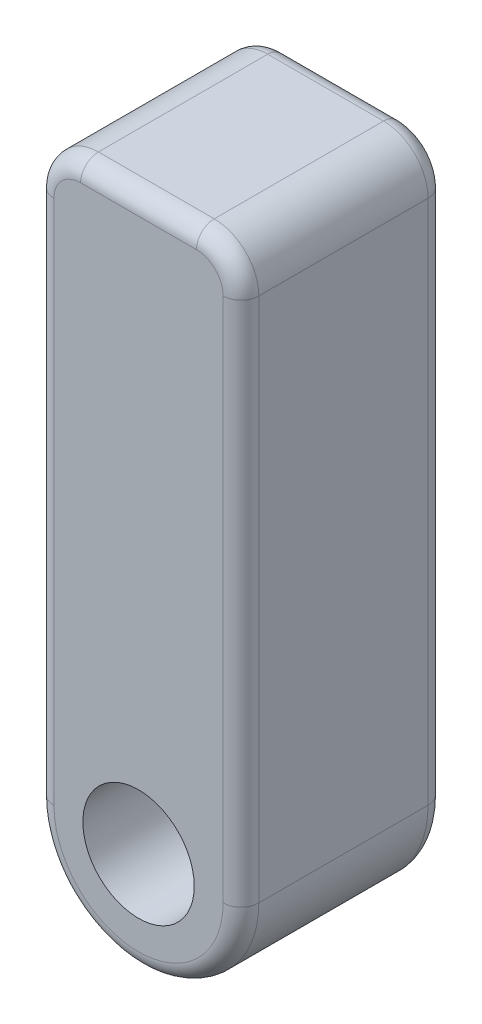
from build123d import *

# Parameters (mm, degrees)
SKETCH1_W           = 10.4
SKETCH1_H           = 15.4
SKETCH1_R           = 6.25
BOSS_EXTRUDE1_DEPTH = 23
CHAMFER2_SIZE       = 1
CHAMFER2_SIZE2      = 2.747477419
FILLET2_R           = 5
FILLET3_R           = 2
SKETCH2_W           = 10.4
SKETCH2_H           = 15.4
BOSS_EXTRUDE2_DEPTH = 1


with BuildPart() as part:
    # Sketch1 → Boss-Extrude1 (new body)
    with BuildSketch(Plane.XY):
        with BuildLine():
            Line((-11.5, 64), (-11.5, 4e-09))
            ThreePointArc((-11.5, 4e-09), (-2e-09, -11.5), (11.5, 0))
            Line((11.5, 0), (11.5, 64))
            Line((11.5, 64), (-11.5, 64))
        make_face()
        with Locations((0, 48.7)):
            Rectangle(SKETCH1_W, SKETCH1_H, mode=Mode.SUBTRACT)
        Circle(SKETCH1_R, mode=Mode.SUBTRACT)
    extrude(amount=BOSS_EXTRUDE1_DEPTH)

    # Chamfer2
    chamfer2_edges = [part.edges().sort_by_distance(p)[0] for p in [
        (5.2, 48.7, 0),
        (0, 41, 0),
        (-5.2, 48.7, 0),
        (0, 56.4, 0),
    ]]
    chamfer2_side = [part.faces().sort_by_distance(p)[0] for p in [
        (0, 27.411701329, 0),
    ]]
    chamfer(chamfer2_edges, length=CHAMFER2_SIZE, length2=CHAMFER2_SIZE2, reference=chamfer2_side[0])

    # Fillet2
    fillet2_edges = [part.edges().sort_by_distance(p)[0] for p in [
        (-11.5, 64, 11.5),
        (11.5, 64, 11.5),
    ]]
    fillet(fillet2_edges, radius=FILLET2_R)

    # Fillet3
    fillet3_edges = [part.edges().sort_by_distance(p)[0] for p in [
        (-2e-09, -11.5, 0),
        (11.5, 29.5, 0),
        (10.035533906, 62.535533906, 0),
        (0, 64, 0),
        (-10.035533906, 62.535533906, 0),
        (-2e-09, -11.5, 23),
        (11.5, 29.5, 23),
        (10.035533906, 62.535533906, 23),
        (0, 64, 23),
        (-10.035533906, 62.535533906, 23),
        (-11.5, 29.500000002, 0),
        (-11.5, 29.500000002, 23),
    ]]
    fillet(fillet3_edges, radius=FILLET3_R)

    # Sketch2 → Boss-Extrude2 (add)
    with BuildSketch(Plane.XY.offset(23)):
        with Locations((0, 48.7)):
            Rectangle(SKETCH2_W, SKETCH2_H)
    extrude(amount=-BOSS_EXTRUDE2_DEPTH)


solid = part.part
